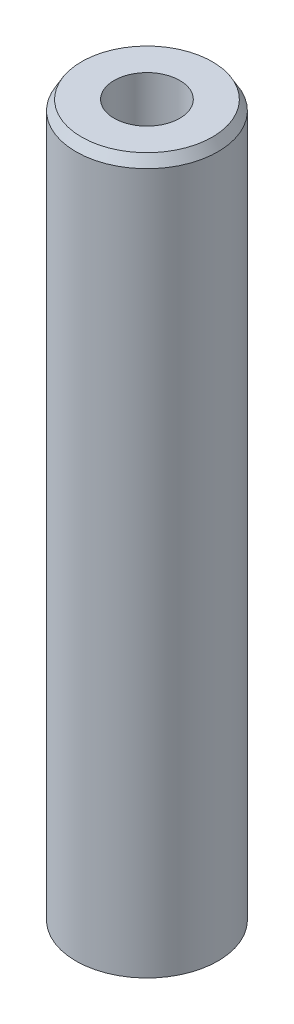
from build123d import *
from OCP.BRepFilletAPI import BRepFilletAPI_MakeChamfer

# Parameters (mm, degrees)
SKETCH1_R           = 12.5
BOSS_EXTRUDE1_DEPTH = 126.050752586
SKETCH2_R           = 5.775686061
CUT_EXTRUDE1_DEPTH  = 128.284296861
CHAMFER1_SIZE       = 1.732390677
CHAMFER1_SIZE2      = 1.000196224


with BuildPart() as part:
    # Sketch1 → Boss-Extrude1 (new body)
    with BuildSketch(Plane(origin=(0, 0, 0), x_dir=(1, 0, 0), z_dir=(0, 1, 0))):
        Circle(SKETCH1_R)
    extrude(amount=BOSS_EXTRUDE1_DEPTH)

    # Sketch2 → Cut-Extrude1 (cut, through all)
    with BuildSketch(Plane(origin=(0, 0, 0), x_dir=(1, 0, 0), z_dir=(0, 1, 0))):
        Circle(SKETCH2_R)
    extrude(amount=CUT_EXTRUDE1_DEPTH, mode=Mode.SUBTRACT)

    # Chamfer1: one chamfer whose edges measure the first distance from different faces: ONE call of the kernel's chamfer builder (chamfer() names one face for all edges)
    chamfer1_edges_1 = [part.edges().sort_by_distance(p)[0] for p in [
        (-12.5, 126.050752586, 0),
    ]]
    chamfer1_side_1 = [part.faces().sort_by_distance(p)[0] for p in [
        (-12.5, 63.025376293, 0),
    ]]
    chamfer1_edges_2 = [part.edges().sort_by_distance(p)[0] for p in [
        (-12.5, 0, 0),
    ]]
    chamfer1_side_2 = [part.faces().sort_by_distance(p)[0] for p in [
        (-12.146446609, 0, 0),
    ]]
    chamfer1 = BRepFilletAPI_MakeChamfer(part.part.solid().wrapped)
    for e in chamfer1_edges_1:
        chamfer1.Add(CHAMFER1_SIZE, CHAMFER1_SIZE2, e.wrapped, chamfer1_side_1[0].wrapped)  # the first distance lies on this face
    for e in chamfer1_edges_2:
        chamfer1.Add(CHAMFER1_SIZE, CHAMFER1_SIZE2, e.wrapped, chamfer1_side_2[0].wrapped)  # the first distance lies on this face
    add(Compound.cast(chamfer1.Shape()), mode=Mode.REPLACE)


solid = part.part
